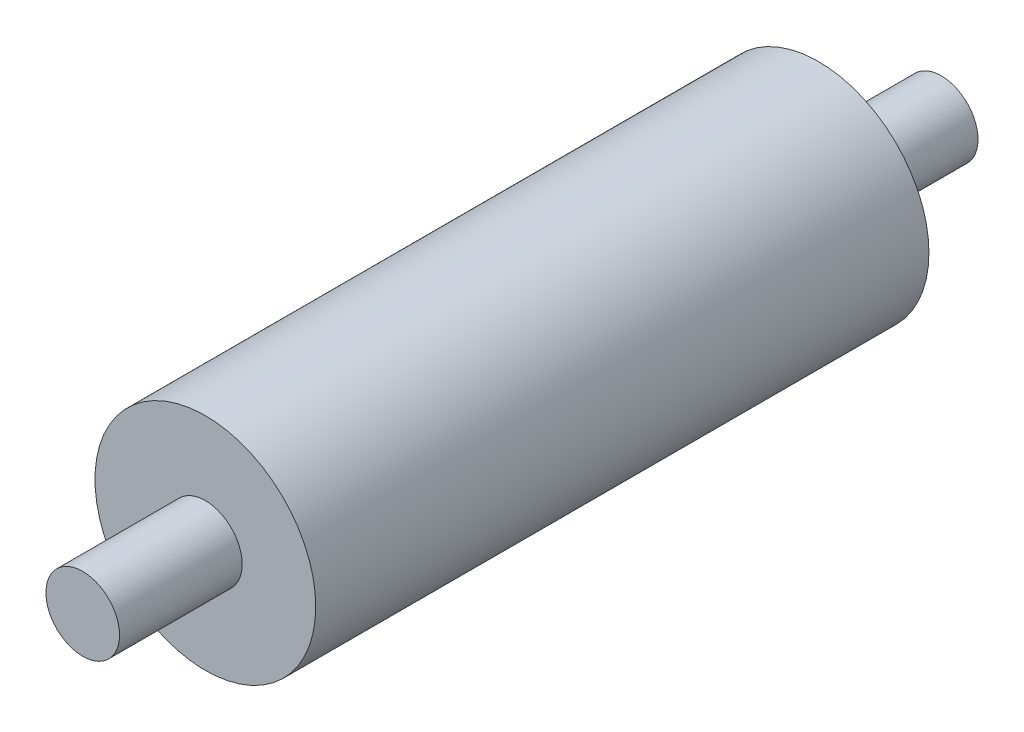
from build123d import *

# Parameters (mm, degrees)
BOSS_EXTRUDE1_DEPTH      = 25
BOSS_EXTRUDE1_DEPTH_BACK = 25
SKETCH1_R                = 9
SKETCH2_R                = 3
BOSS_EXTRUDE2_DEPTH      = 10


with BuildPart() as part:
    # Sketch1 → Boss-Extrude1 (new, two sides: drawn at the far end of the back side and taken through both)
    with BuildSketch(Plane.XY.offset(-BOSS_EXTRUDE1_DEPTH_BACK)):
        Circle(SKETCH1_R)
    extrude(amount=BOSS_EXTRUDE1_DEPTH + BOSS_EXTRUDE1_DEPTH_BACK)

    # Sketch2 → Boss-Extrude2 (add)
    with BuildSketch(Plane.XY.offset(25)):
        Circle(SKETCH2_R)
    boss_extrude2 = extrude(amount=BOSS_EXTRUDE2_DEPTH)

    # Mirror1: Boss-Extrude2 across plane
    add(boss_extrude2.mirror(Plane.XY))


solid = part.part
